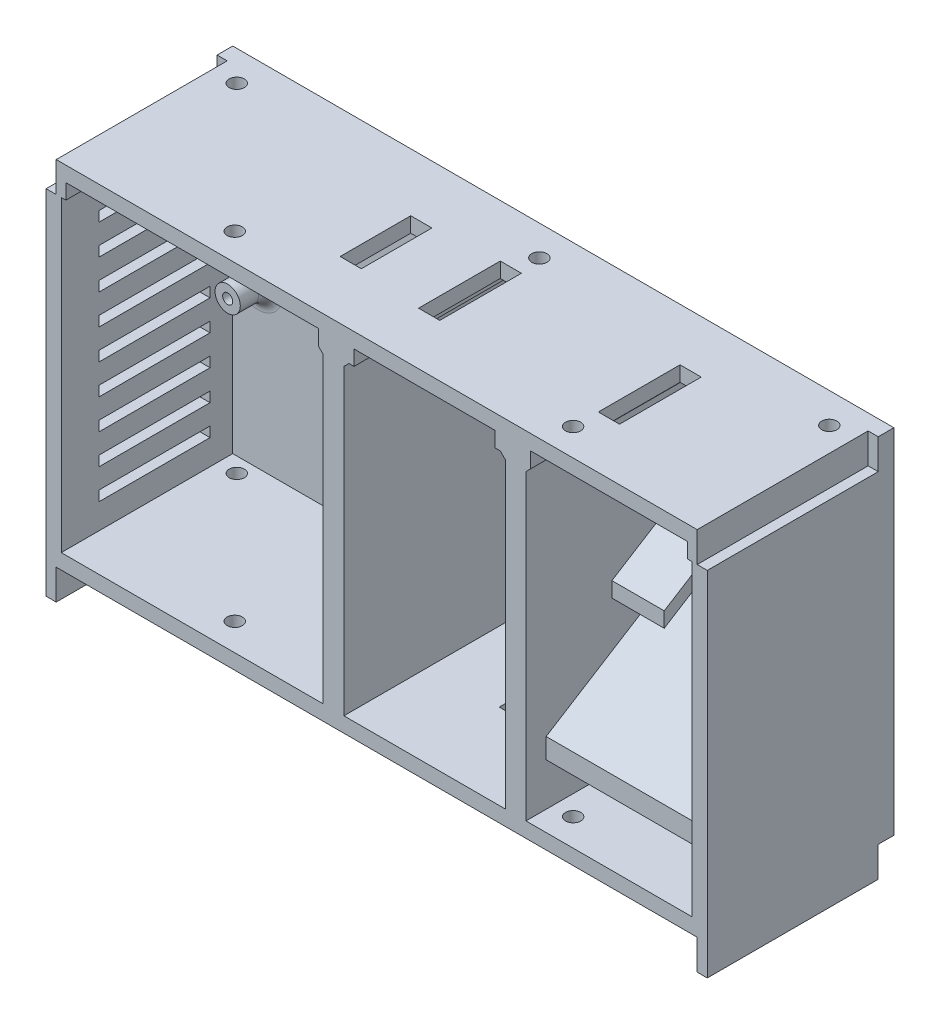
from build123d import *

# Parameters (mm, degrees)
CROQUIS1_W               = 32.1
CROQUIS1_H               = 6
CROQUIS1_W_2             = 53
CROQUIS1_W_3             = 34
CROQUIS1_W_4             = 2
CROQUIS1_W_5             = 1
SALIENTE_EXTRUIR1_DEPTH  = 34
SALIENTE_EXTRUIR2_DEPTH  = 3
SALIENTE_EXTRUIR3_DEPTH  = 31
SALIENTE_EXTRUIR4_DEPTH  = 3
CROQUIS5_W               = 4.1
CROQUIS5_H               = 61
SALIENTE_EXTRUIR10_DEPTH = 31
CORTAR_EXTRUIR1_REACH    = 151.797
CROQUIS6_W               = 4.2
CROQUIS6_H               = 14
CROQUIS6_H_2             = 16.2
CORTAR_EXTRUIR2_START    = -31
CROQUIS7_W               = 25.05
CROQUIS7_H               = 3
CROQUIS7_W_2             = 14
CROQUIS7_W_3             = 15.6
CORTAR_EXTRUIR2_DEPTH    = 31
CORTAR_EXTRUIR8_DEPTH    = 3
CROQUIS24_W              = 4.416361802
CROQUIS24_H              = 6.54510403
CORTAR_EXTRUIR11_DEPTH   = 149.050025329
CROQUIS26_W              = 10
CROQUIS26_H              = 6
CROQUIS26_R              = 2.5
CROQUIS26_R_2            = 1
SALIENTE_EXTRUIR16_DEPTH = 6
REDONDEO1_R              = 2.4
CHAFL_N1_SIZE            = 1
CROQUIS10_W              = 22
CROQUIS10_H              = 2
CORTAR_EXTRUIR3_DEPTH    = 3
SALIENTE_EXTRUIR12_DEPTH = 32.95
SALIENTE_EXTRUIR17_DEPTH = 32.95
CROQUIS38_W              = 6.1
CROQUIS38_H              = 26
CORTAR_EXTRUIR12_DEPTH   = 14.749596
CORTAR_EXTRUIR13_REACH   = 153.103
CROQUIS40_R              = 1.5
CROQUIS48_W              = 3.1
CROQUIS48_H              = 6
SALIENTE_EXTRUIR20_DEPTH = 131.1
CROQUIS49_W              = 2
CROQUIS49_H              = 6
SALIENTE_EXTRUIR21_DEPTH = 33.9
CROQUIS50_R              = 1.5
CORTAR_EXTRUIR14_DEPTH   = 3
CROQUIS51_W              = 0.1
CROQUIS51_H              = 70
CORTAR_EXTRUIR15_DEPTH   = 153.457239907
CROQUIS52_W              = 6
CROQUIS52_H              = 8
CORTAR_EXTRUIR16_DEPTH   = 3
CROQUIS53_W              = 32.95
CROQUIS53_H              = 4
CROQUIS53_H_2            = 2.672226941
CORTAR_EXTRUIR17_DEPTH   = 4
CROQUIS54_W              = 131.1
CROQUIS54_H              = 70
SALIENTE_EXTRUIR22_DEPTH = 0.1
CROQUIS55_R              = 2.2
CROQUIS55_R_2            = 1.1
SALIENTE_EXTRUIR23_DEPTH = 5
REDONDEO2_R              = 2.56


with BuildPart() as part:
    # Croquis1 → Saliente-Extruir1 (new body)
    with BuildSketch(Plane.XY):
        with Locations((75.05, 3)):
            Rectangle(CROQUIS1_W, CROQUIS1_H)
        with Locations((28.5, 3)):
            Rectangle(CROQUIS1_W_2, CROQUIS1_H)
        with Locations((112.1, 3)):
            Rectangle(CROQUIS1_W_3, CROQUIS1_H)
        with Locations((93.1, 3)):
            Rectangle(CROQUIS1_W_4, CROQUIS1_H)
        with Locations((57, 3)):
            Rectangle(CROQUIS1_W_4, CROQUIS1_H)
        with Locations((55.5, 3)):
            Rectangle(CROQUIS1_W_5, CROQUIS1_H)
        with Locations((58.5, 3)):
            Rectangle(CROQUIS1_W_5, CROQUIS1_H)
        with Locations((94.6, 3)):
            Rectangle(CROQUIS1_W_5, CROQUIS1_H)
        with Locations((91.6, 3)):
            Rectangle(CROQUIS1_W_5, CROQUIS1_H)
    extrude(amount=SALIENTE_EXTRUIR1_DEPTH)

    # Croquis2 → Saliente-Extruir2 (add)
    with BuildSketch(Plane.XY):
        Polygon((2, -64), (129.1, -64), (131.1, -64), (131.1, 0), (129.1, 0), (2, 0), (0, 0), (0, -64), align=None)
    extrude(amount=SALIENTE_EXTRUIR2_DEPTH)

    # Croquis3 → Saliente-Extruir3 (add)
    with BuildSketch(Plane.XY.offset(3)):
        Polygon((131.1, 0), (128.1, 0), (128.1, -61), (3, -61), (3, 0), (0, 0), (0, -64), (3, -64), (128.1, -64), (131.1, -64), align=None)
    extrude(amount=SALIENTE_EXTRUIR3_DEPTH)

    # Croquis4 → Saliente-Extruir4 (add)
    with BuildSketch(Plane(origin=(0, 0, 0), x_dir=(-1, 0, 0), z_dir=(0, 0, -1))):
        Polygon((-2, 6), (-129.1, 6), (-129.1, 0), (-131.1, 0), (-131.1, -64), (0, -64), (0, 0), (-2, 0), align=None)
    extrude(amount=SALIENTE_EXTRUIR4_DEPTH)

    # Croquis5 → Saliente-Extruir10 (add)
    with BuildSketch(Plane.XY.offset(3)):
        with Locations((57, -30.5)):
            Rectangle(CROQUIS5_W, CROQUIS5_H)
        with Locations((93.1, -30.5)):
            Rectangle(CROQUIS5_W, CROQUIS5_H)
    extrude(amount=SALIENTE_EXTRUIR10_DEPTH)

    # Croquis6 → Cortar-Extruir1 (cut, up to next)
    with BuildSketch(Plane.XZ, mode=Mode.PRIVATE) as cortar_extruir1_sk1:
        with Locations((48.9, 15.5)):
            Rectangle(CROQUIS6_W, CROQUIS6_H)
    cortar_extruir1_tool1 = extrude(cortar_extruir1_sk1.sketch, amount=-CORTAR_EXTRUIR1_REACH, mode=Mode.PRIVATE) & part.part
    # Croquis6 → Cortar-Extruir1 (cut, up to next)
    with BuildSketch(Plane.XZ, mode=Mode.PRIVATE) as cortar_extruir1_sk2:
        with Locations((101.2, 15.5)):
            Rectangle(CROQUIS6_W, CROQUIS6_H_2)
    cortar_extruir1_tool2 = extrude(cortar_extruir1_sk2.sketch, amount=-CORTAR_EXTRUIR1_REACH, mode=Mode.PRIVATE) & part.part
    # Croquis6 → Cortar-Extruir1 (cut, up to next)
    with BuildSketch(Plane.XZ, mode=Mode.PRIVATE) as cortar_extruir1_sk3:
        with Locations((65.55, 15.5)):
            Rectangle(CROQUIS6_W, CROQUIS6_H_2)
    cortar_extruir1_tool3 = extrude(cortar_extruir1_sk3.sketch, amount=-CORTAR_EXTRUIR1_REACH, mode=Mode.PRIVATE) & part.part
    add(cortar_extruir1_tool1.solids().sort_by_distance((48.9, 0, 15.5))[0], mode=Mode.SUBTRACT)
    add(cortar_extruir1_tool2.solids().sort_by_distance((101.2, 0, 15.5))[0], mode=Mode.SUBTRACT)
    add(cortar_extruir1_tool3.solids().sort_by_distance((65.55, 0, 15.5))[0], mode=Mode.SUBTRACT)

    # Croquis7 → Cortar-Extruir2 (cut)
    with BuildSketch(Plane.XY.offset(34).offset(CORTAR_EXTRUIR2_START)):
        with Locations((41.5, 1.5)):
            Rectangle(CROQUIS7_W, CROQUIS7_H)
        with Locations((16.45, 1.5)):
            Rectangle(CROQUIS7_W, CROQUIS7_H)
        with Locations((68.05, 1.5)):
            Rectangle(CROQUIS7_W_2, CROQUIS7_H)
        with Locations((82.05, 1.5)):
            Rectangle(CROQUIS7_W_2, CROQUIS7_H)
        with Locations((103.825, 1.5)):
            Rectangle(CROQUIS7_W_3, CROQUIS7_H)
        with Locations((119.425, 1.5)):
            Rectangle(CROQUIS7_W_3, CROQUIS7_H)
    extrude(amount=CORTAR_EXTRUIR2_DEPTH, mode=Mode.SUBTRACT)

    # Croquis22 → Cortar-Extruir8 (cut)
    with BuildSketch(Plane.XY.offset(3)):
        Polygon((95.15, 0), (95.15, -61), (128.1, -61), (128.1, 0), (127.225, 0), (127.225, 3), (96.025, 3), (96.025, 0), align=None)
        Polygon((91.05, -61), (91.05, 0), (89.05, 0), (89.05, 3), (61.05, 3), (61.05, 0), (59.05, 0), (59.05, -61), align=None)
        Polygon((54.95, -61), (54.95, 0), (54.025, 0), (54.025, 3), (3.925, 3), (3.925, 0), (3, 0), (3, -61), align=None)
    extrude(amount=-CORTAR_EXTRUIR8_DEPTH, mode=Mode.SUBTRACT)

    # Croquis24 → Cortar-Extruir11 (cut, through all)
    with BuildSketch(Plane.ZY.offset(-2)):
        with Locations((-2.108180901, 3.272552015)):
            Rectangle(CROQUIS24_W, CROQUIS24_H)
    extrude(amount=-CORTAR_EXTRUIR11_DEPTH, mode=Mode.SUBTRACT)

    # Croquis26 → Saliente-Extruir16 (add)
    # profile 1 of 3: a face of its own
    with BuildSketch(Plane.XY):
        with Locations((41.1, -42)):
            Rectangle(CROQUIS26_W, CROQUIS26_H)
    # profile 2 of 3: a face of its own
    with BuildSketch(Plane.XY):
        with Locations((24, -8.1)):
            Circle(CROQUIS26_R)
        with Locations((24, -8.1)):
            Circle(CROQUIS26_R_2, mode=Mode.SUBTRACT)
    # profile 3 of 3: a face of its own
    with BuildSketch(Plane.XY):
        with Locations((8, -28.9)):
            Circle(CROQUIS26_R)
        with Locations((8, -28.9)):
            Circle(CROQUIS26_R_2, mode=Mode.SUBTRACT)
    extrude(amount=SALIENTE_EXTRUIR16_DEPTH)

    # Redondeo1
    redondeo1_edges = [part.edges().sort_by_distance(p)[0] for p in [
        (46.1, -42, 0),
        (21.5, -8.1, 0),
        (5.5, -28.9, 0),
    ]]
    fillet(redondeo1_edges, radius=REDONDEO1_R)

    # Chaflán1
    # the kernel refuses this chamfer: 1 mm, written as the material it adds along each edge
    with BuildSketch(Plane(origin=(54.95, 0, 0.1), x_dir=(-0.999621916911297, 0.027495876610581345, -3.545811902192288e-15), z_dir=(0, 0, 1))) as chafl_n1_piece_1_section:
        Polygon((CHAFL_N1_SIZE * 0.999621916911, CHAFL_N1_SIZE * 0.0274958766106), (-CHAFL_N1_SIZE * 0.0274958766105, CHAFL_N1_SIZE * 0.999621916911), (0, 0), align=None)
    chafl_n1_piece_1 = extrude(amount=33.9, mode=Mode.PRIVATE)
    chafl_n1_piece_1 = split(chafl_n1_piece_1, bisect_by=Plane(origin=(54.025, -0.335077519, 17.05), z_dir=(1, 0, 0)), keep=Keep.TOP, mode=Mode.PRIVATE)
    add(chafl_n1_piece_1)
    with BuildSketch(Plane(origin=(95.15, 0, 34), x_dir=(0.9996219169112968, 0.027495876610586518, 0), z_dir=(0, 0, -1))) as chafl_n1_piece_2_section:
        Polygon((CHAFL_N1_SIZE * 0.999621916911, CHAFL_N1_SIZE * 0.0274958766106), (-CHAFL_N1_SIZE * 0.0274958766106, CHAFL_N1_SIZE * 0.999621916911), (0, 0), align=None)
    chafl_n1_piece_2 = extrude(amount=33.9, mode=Mode.PRIVATE)
    chafl_n1_piece_2 = split(chafl_n1_piece_2, bisect_by=Plane(origin=(96.025, -0.337962963, 17.05), z_dir=(-1, 0, 0)), keep=Keep.TOP, mode=Mode.PRIVATE)
    add(chafl_n1_piece_2)
    with BuildSketch(Plane(origin=(91.05, 0, 0.1), x_dir=(0.027495876610582174, -0.9996219169112968, 0), z_dir=(0, 0, 1))) as chafl_n1_piece_3:
        Polygon((CHAFL_N1_SIZE * 0.999621916911, -CHAFL_N1_SIZE * 0.0274958766106), (-CHAFL_N1_SIZE * 0.0274958766106, -CHAFL_N1_SIZE * 0.999621916911), (0, 0), align=None)
    extrude(amount=33.9)
    with BuildSketch(Plane(origin=(59.05, 0, 34), x_dir=(0.9996219169112968, 0.027495876610586327, 3.139518069145253e-15), z_dir=(0, 0, -1))) as chafl_n1_piece_4:
        Polygon((CHAFL_N1_SIZE * 0.999621916911, CHAFL_N1_SIZE * 0.0274958766106), (-CHAFL_N1_SIZE * 0.0274958766106, CHAFL_N1_SIZE * 0.999621916911), (0, 0), align=None)
    extrude(amount=33.9)

    # Croquis10 → Cortar-Extruir3 (cut)
    with BuildSketch(Plane.ZY):
        with Locations((15.5, -55)):
            Rectangle(CROQUIS10_W, CROQUIS10_H)
        with Locations((15.5, -49)):
            Rectangle(CROQUIS10_W, CROQUIS10_H)
        with Locations((15.5, -43)):
            Rectangle(CROQUIS10_W, CROQUIS10_H)
        with Locations((15.5, -37)):
            Rectangle(CROQUIS10_W, CROQUIS10_H)
        with Locations((15.5, -31)):
            Rectangle(CROQUIS10_W, CROQUIS10_H)
        with Locations((15.5, -25)):
            Rectangle(CROQUIS10_W, CROQUIS10_H)
        with Locations((15.5, -19)):
            Rectangle(CROQUIS10_W, CROQUIS10_H)
        with Locations((15.5, -13)):
            Rectangle(CROQUIS10_W, CROQUIS10_H)
        with Locations((15.5, -7)):
            Rectangle(CROQUIS10_W, CROQUIS10_H)
    extrude(amount=-CORTAR_EXTRUIR3_DEPTH, mode=Mode.SUBTRACT)

    # Croquis12 → Saliente-Extruir12 (add)
    with BuildSketch(Plane(origin=(95.15, 0, 0), x_dir=(0, 0, -1), z_dir=(1, 0, 0))):
        Polygon((0, -29.754442035), (-34, -51), (-34, -55), (0, -33.754442035), align=None)
    extrude(amount=SALIENTE_EXTRUIR12_DEPTH)

    # Croquis13 → Saliente-Extruir17 (add)
    with BuildSketch(Plane(origin=(95.15, 0, 0), x_dir=(0, 0, -1), z_dir=(1, 0, 0))):
        Polygon((0, -29.754442035), (0, -20.654442035), (-4.240240481, -23.304038356), (-4.240240481, -32.404038356), align=None)
        Polygon((-4.240240481, -23.304038356), (0, -20.654442035), (0, -17.654442035), (-16.960961923, -28.25282732), (-16.960961923, -31.25282732), align=None)
    extrude(amount=SALIENTE_EXTRUIR17_DEPTH)

    # Croquis38 → Cortar-Extruir12 (cut)
    with BuildSketch(Plane(origin=(0, -17.654442035, 0), x_dir=(-1, 0, 0), z_dir=(0, -1, 0))):
        with Locations((-114.675, -13)):
            Rectangle(CROQUIS38_W, CROQUIS38_H)
        with Locations((-108.575, -13)):
            Rectangle(CROQUIS38_W, CROQUIS38_H)
    extrude(amount=CORTAR_EXTRUIR12_DEPTH, mode=Mode.SUBTRACT)

    # Croquis40 → Cortar-Extruir13 (cut, up to next)
    with BuildSketch(Plane.XZ.offset(-3), mode=Mode.PRIVATE) as cortar_extruir13_sk1:
        with Locations(Location((32, 28.6, 0), (0, 0, 270))):
            Circle(CROQUIS40_R)
    cortar_extruir13_tool1 = extrude(cortar_extruir13_sk1.sketch, amount=-CORTAR_EXTRUIR13_REACH, mode=Mode.PRIVATE) & part.part
    # Croquis40 → Cortar-Extruir13 (cut, up to next)
    with BuildSketch(Plane.XZ.offset(-3), mode=Mode.PRIVATE) as cortar_extruir13_sk2:
        with Locations(Location((99.1, 28.6, 0), (0, 0, 270))):
            Circle(CROQUIS40_R)
    cortar_extruir13_tool2 = extrude(cortar_extruir13_sk2.sketch, amount=-CORTAR_EXTRUIR13_REACH, mode=Mode.PRIVATE) & part.part
    # Croquis40 → Cortar-Extruir13 (cut, up to next)
    with BuildSketch(Plane.XZ.offset(-3), mode=Mode.PRIVATE) as cortar_extruir13_sk3:
        with Locations(Location((6.8, 3, 0), (0, 0, 270))):
            Circle(CROQUIS40_R)
    cortar_extruir13_tool3 = extrude(cortar_extruir13_sk3.sketch, amount=-CORTAR_EXTRUIR13_REACH, mode=Mode.PRIVATE) & part.part
    # Croquis40 → Cortar-Extruir13 (cut, up to next)
    with BuildSketch(Plane.XZ.offset(-3), mode=Mode.PRIVATE) as cortar_extruir13_sk4:
        with Locations(Location((124.3, 3, 0), (0, 0, 270))):
            Circle(CROQUIS40_R)
    cortar_extruir13_tool4 = extrude(cortar_extruir13_sk4.sketch, amount=-CORTAR_EXTRUIR13_REACH, mode=Mode.PRIVATE) & part.part
    # Croquis40 → Cortar-Extruir13 (cut, up to next)
    with BuildSketch(Plane.XZ.offset(-3), mode=Mode.PRIVATE) as cortar_extruir13_sk5:
        with Locations(Location((66.8, 3, 0), (0, 0, 270))):
            Circle(CROQUIS40_R)
    cortar_extruir13_tool5 = extrude(cortar_extruir13_sk5.sketch, amount=-CORTAR_EXTRUIR13_REACH, mode=Mode.PRIVATE) & part.part
    add(cortar_extruir13_tool1.solids().sort_by_distance((32, 3, 28.6))[0], mode=Mode.SUBTRACT)
    add(cortar_extruir13_tool2.solids().sort_by_distance((99.1, 3, 28.6))[0], mode=Mode.SUBTRACT)
    add(cortar_extruir13_tool3.solids().sort_by_distance((6.8, 3, 3))[0], mode=Mode.SUBTRACT)
    add(cortar_extruir13_tool4.solids().sort_by_distance((124.3, 3, 3))[0], mode=Mode.SUBTRACT)
    add(cortar_extruir13_tool5.solids().sort_by_distance((66.8, 3, 3))[0], mode=Mode.SUBTRACT)

    # Croquis48 → Saliente-Extruir20 (add)
    with BuildSketch(Plane.ZY):
        with Locations((-1.45, 3)):
            Rectangle(CROQUIS48_W, CROQUIS48_H)
    extrude(amount=-SALIENTE_EXTRUIR20_DEPTH)

    # Croquis49 → Saliente-Extruir21 (add)
    with BuildSketch(Plane.XY.offset(34)):
        with Locations((1, -67)):
            Rectangle(CROQUIS49_W, CROQUIS49_H)
        with Locations((130.1, -67)):
            Rectangle(CROQUIS49_W, CROQUIS49_H)
    extrude(amount=-SALIENTE_EXTRUIR21_DEPTH)

    # Croquis50 → Cortar-Extruir14 (cut)
    with BuildSketch(Plane.XZ.offset(64)):
        with Locations(Location((124.3, 3, 0), (0, 0, 270))):
            Circle(CROQUIS50_R)
        with Locations(Location((99.1, 28.6, 0), (0, 0, 270))):
            Circle(CROQUIS50_R)
        with Locations(Location((6.8, 3, 0), (0, 0, 270))):
            Circle(CROQUIS50_R)
        with Locations(Location((32, 28.6, 0), (0, 0, 270))):
            Circle(CROQUIS50_R)
    extrude(amount=-CORTAR_EXTRUIR14_DEPTH, mode=Mode.SUBTRACT)

    # Croquis51 → Cortar-Extruir15 (cut, through all)
    with BuildSketch(Plane.ZY):
        with Locations((-2.95, -29)):
            Rectangle(CROQUIS51_W, CROQUIS51_H)
    extrude(amount=-CORTAR_EXTRUIR15_DEPTH, mode=Mode.SUBTRACT)

    # Croquis52 → Cortar-Extruir16 (cut)
    with BuildSketch(Plane.XZ.offset(64)):
        with Locations((75.95, 13.1)):
            Rectangle(CROQUIS52_W, CROQUIS52_H)
    extrude(amount=-CORTAR_EXTRUIR16_DEPTH, mode=Mode.SUBTRACT)

    # Croquis53 → Cortar-Extruir17 (cut)
    with BuildSketch(Plane.XY.offset(34)):
        with Locations((111.625, -53)):
            Rectangle(CROQUIS53_W, CROQUIS53_H)
        with Locations((111.625, -49.66388653)):
            Rectangle(CROQUIS53_W, CROQUIS53_H_2)
    extrude(amount=-CORTAR_EXTRUIR17_DEPTH, mode=Mode.SUBTRACT)

    # Croquis54 → Saliente-Extruir22 (add)
    with BuildSketch(Plane(origin=(0, 0, -2.9), x_dir=(-1, 0, 0), z_dir=(0, 0, -1))):
        with Locations((-65.55, -29)):
            Rectangle(CROQUIS54_W, CROQUIS54_H)
    extrude(amount=SALIENTE_EXTRUIR22_DEPTH)

    # Croquis55 → Saliente-Extruir23 (add)
    # profile 1 of 4: a face of its own
    with BuildSketch(Plane.XY):
        with Locations((65.25, -27)):
            Circle(CROQUIS55_R)
        with Locations((65.25, -27)):
            Circle(CROQUIS55_R_2, mode=Mode.SUBTRACT)
    # profile 2 of 4: a face of its own
    with BuildSketch(Plane.XY):
        with Locations((83.95, -27)):
            Circle(CROQUIS55_R)
        with Locations((83.95, -27)):
            Circle(CROQUIS55_R_2, mode=Mode.SUBTRACT)
    # profile 3 of 4: a face of its own
    with BuildSketch(Plane.XY):
        with Locations((83.95, -56.4)):
            Circle(CROQUIS55_R)
        with Locations((83.95, -56.4)):
            Circle(CROQUIS55_R_2, mode=Mode.SUBTRACT)
    # profile 4 of 4: a face of its own
    with BuildSketch(Plane.XY):
        with Locations((65.25, -56.4)):
            Circle(CROQUIS55_R)
        with Locations((65.25, -56.4)):
            Circle(CROQUIS55_R_2, mode=Mode.SUBTRACT)
    extrude(amount=SALIENTE_EXTRUIR23_DEPTH)

    # Redondeo2
    # the kernel refuses this fillet: 2.56 mm, written as the material it adds along each edge
    with BuildSketch(Plane(origin=(65.25, -27, 0), x_dir=(1, 0, 0), z_dir=(0, -1, 0))) as redondeo2_piece_1:
        with BuildLine():
            CenterArc((2.2 + REDONDEO2_R, REDONDEO2_R), REDONDEO2_R, 180, 90)
            Line((2.2, REDONDEO2_R), (2.2, 0))
            Line((2.2, 0), (2.2 + REDONDEO2_R, 0))
        make_face()
    revolve(axis=Axis((65.25, -27, 0), (0, 0, 1)))
    with BuildSketch(Plane(origin=(83.95, -27, 0), x_dir=(1, 0, 0), z_dir=(0, -1, 0))) as redondeo2_piece_2:
        with BuildLine():
            CenterArc((2.2 + REDONDEO2_R, REDONDEO2_R), REDONDEO2_R, 180, 90)
            Line((2.2, REDONDEO2_R), (2.2, 0))
            Line((2.2, 0), (2.2 + REDONDEO2_R, 0))
        make_face()
    revolve(axis=Axis((83.95, -27, 0), (0, 0, 1)))
    with BuildSketch(Plane(origin=(83.95, -56.4, 0), x_dir=(1, 0, 0), z_dir=(0, -1, 0))) as redondeo2_piece_3:
        with BuildLine():
            CenterArc((2.2 + REDONDEO2_R, REDONDEO2_R), REDONDEO2_R, 180, 90)
            Line((2.2, REDONDEO2_R), (2.2, 0))
            Line((2.2, 0), (2.2 + REDONDEO2_R, 0))
        make_face()
    revolve(axis=Axis((83.95, -56.4, 0), (0, 0, 1)))
    with BuildSketch(Plane(origin=(65.25, -56.4, 0), x_dir=(1, 0, 0), z_dir=(0, -1, 0))) as redondeo2_piece_4:
        with BuildLine():
            CenterArc((2.2 + REDONDEO2_R, REDONDEO2_R), REDONDEO2_R, 180, 90)
            Line((2.2, REDONDEO2_R), (2.2, 0))
            Line((2.2, 0), (2.2 + REDONDEO2_R, 0))
        make_face()
    revolve(axis=Axis((65.25, -56.4, 0), (0, 0, 1)))


solid = part.part
